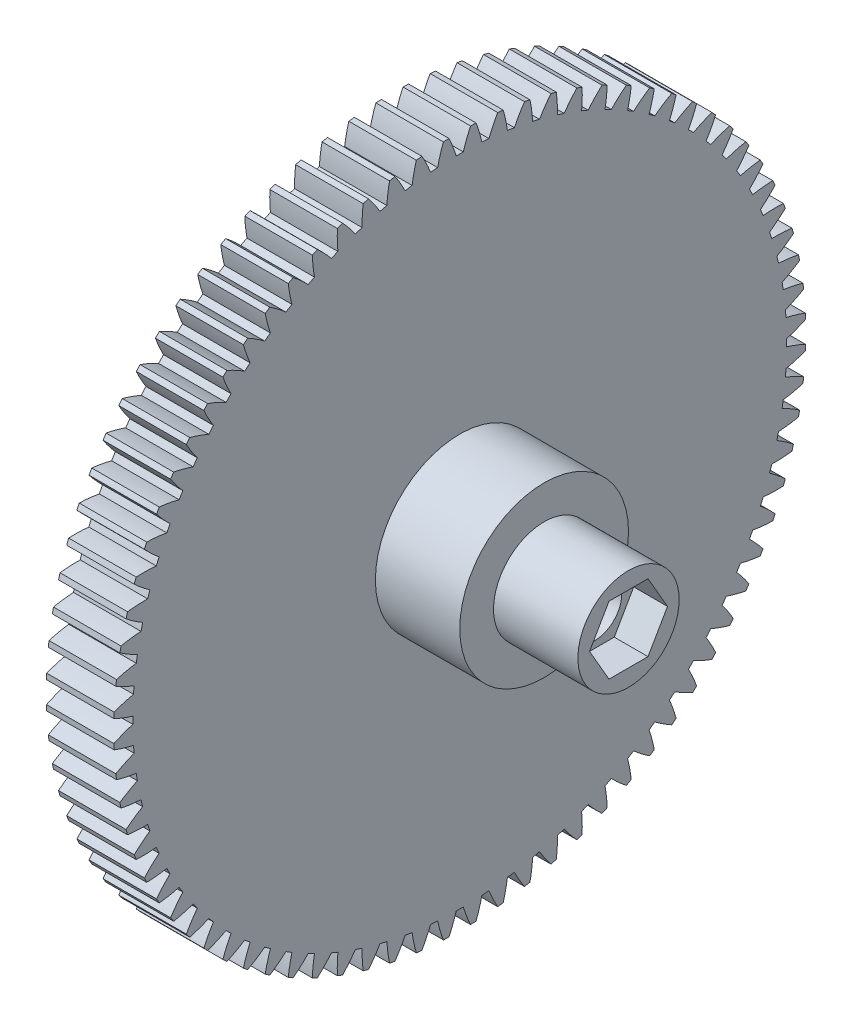
from build123d import *

# Parameters (mm, degrees)
BASPROSKE_W              = 8
BASPROSKE_H              = 41
TOOTHCUT_DEPTH           = 59.532042507
TEETHCUTS_COUNT          = 80
TEETHCUTS_ANGLE          = 355.5
BORSKE_R                 = 5
BORE_DEPTH               = 50.0000508
ESBO_O1_R                = 10
RESSALTO_EXTRUS_O1_DEPTH = 10
ESBO_O2_R                = 6
RESSALTO_EXTRUS_O2_DEPTH = 10
CORTE_EXTRUS_O1_DEPTH    = 4
ESBO_O4_R                = 5
RESSALTO_EXTRUS_O3_DEPTH = 8
ESBO_O5_R                = 3.2
CORTE_EXTRUS_O2_DEPTH    = 63.727371974
FILETE1_R                = 20


with BuildPart() as part:
    # BasProSke → Base-Revolve (revolve)
    with BuildSketch(Plane(origin=(0, 0, 0), x_dir=(1, 0, 0), z_dir=(0, 1, 0)), mode=Mode.PRIVATE) as base_revolve_sk:
        with Locations((4, 20.5)):
            Rectangle(BASPROSKE_W, BASPROSKE_H)
    revolve(base_revolve_sk.sketch.rotate(Axis((-10, 0, 0), (1, 0, 0)), 180), axis=Axis((-10, 0, 0), (1, 0, 0)))

    # TooCutSke → ToothCut (cut, through all)
    with BuildSketch(Plane(origin=(0, 0, 0), x_dir=(0, 0, -1), z_dir=(1, 0, 0))):
        with BuildLine():
            ThreePointArc((0.420555483, 38.74671772), (0, 38.749), (-0.420555483, 38.74671772))
            ThreePointArc((-0.420555483, 38.74671772), (-0.81345102, 39.892387293), (-1.291883564, 41.005054347))
            ThreePointArc((-1.291883564, 41.005054347), (0, 41.0254), (1.291883564, 41.005054347))
            ThreePointArc((1.291883564, 41.005054347), (0.81345102, 39.892387293), (0.420555483, 38.74671772))
        make_face()
    toothcut = extrude(amount=TOOTHCUT_DEPTH, mode=Mode.SUBTRACT)

    # TeethCuts: ToothCut ×80 about axis
    teethcuts_axis = Axis((-10, 0, 0), (1, 0, 0))
    for i in range(1, TEETHCUTS_COUNT):
        add(toothcut.rotate(teethcuts_axis, i * TEETHCUTS_ANGLE / (TEETHCUTS_COUNT - 1)), mode=Mode.SUBTRACT)

    # BorSke → Bore (cut, symmetric)
    with BuildSketch(Plane(origin=(0, 0, 0), x_dir=(0, 0, -1), z_dir=(1, 0, 0))):
        with Locations(Location((0, 0, 0), (0, 0, 180))):
            Circle(BORSKE_R)
    extrude(amount=BORE_DEPTH, both=True, mode=Mode.SUBTRACT)

    # Esboço1 → Ressalto-extrusão1 (add)
    with BuildSketch(Plane(origin=(8, 0, 0), x_dir=(0, 0, -1), z_dir=(1, 0, 0))):
        with Locations(Location((0, 0, 0), (0, 0, 180))):
            Circle(ESBO_O1_R)
    extrude(amount=RESSALTO_EXTRUS_O1_DEPTH)

    # Esboço2 → Ressalto-extrusão2 (add)
    with BuildSketch(Plane(origin=(18, 0, 0), x_dir=(0, 0, -1), z_dir=(1, 0, 0))):
        Circle(ESBO_O2_R)
    extrude(amount=RESSALTO_EXTRUS_O2_DEPTH)

    # Esboço3 → Corte-extrusão1 (cut)
    with BuildSketch(Plane(origin=(28, 0, 0), x_dir=(0, 0, -1), z_dir=(1, 0, 0))):
        Polygon((-4.618802154, 0), (-2.309401077, -4), (2.309401077, -4), (4.618802154, 0), (2.309401077, 4), (-2.309401077, 4), align=None)
    extrude(amount=-CORTE_EXTRUS_O1_DEPTH, mode=Mode.SUBTRACT)

    # Esboço4 → Ressalto-extrusão3 (add)
    with BuildSketch(Plane.ZY.offset(-8)):
        Circle(ESBO_O4_R)
    extrude(amount=RESSALTO_EXTRUS_O3_DEPTH)

    # Esboço5 → Corte-extrusão2 (cut, through all)
    with BuildSketch(Plane(origin=(24, 0, 0), x_dir=(0, 0, -1), z_dir=(1, 0, 0))):
        Circle(ESBO_O5_R)
    extrude(amount=-CORTE_EXTRUS_O2_DEPTH, mode=Mode.SUBTRACT)

    # Filete1
    filete1_edges = [part.edges().sort_by_distance(p)[0] for p in [
        (0, 0, 3.2),
    ]]
    fillet(filete1_edges, radius=FILETE1_R)


solid = part.part
